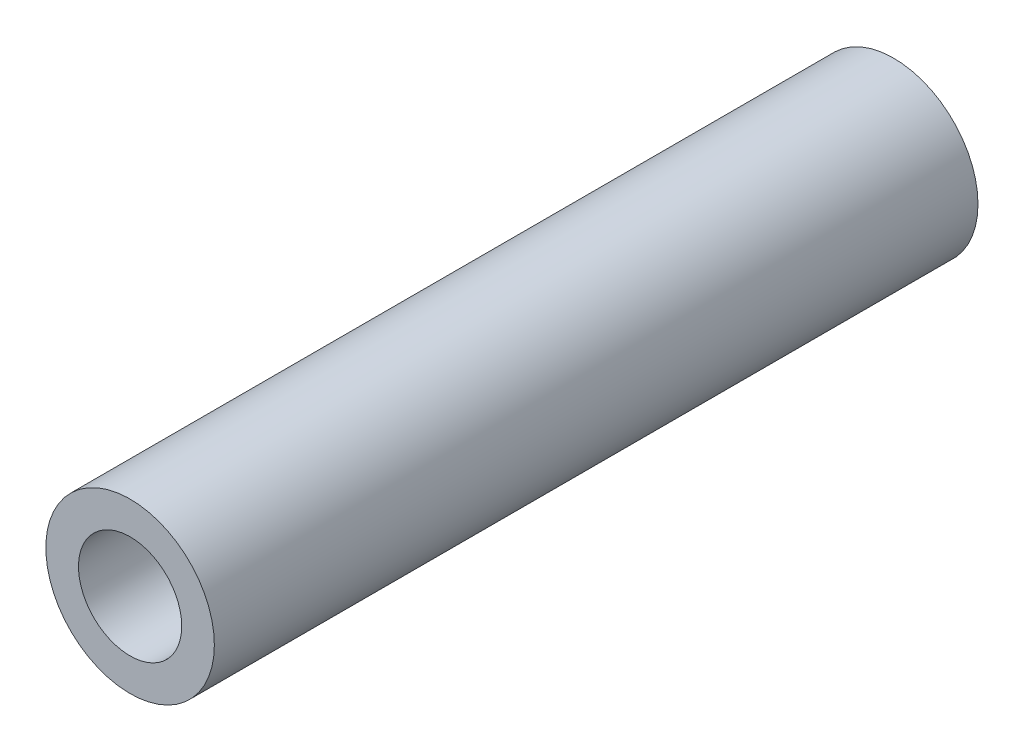
from build123d import *

# Parameters (mm, degrees)
SKETCH1_R           = 4.064
SKETCH1_R_2         = 2.4892
BOSS_EXTRUDE1_DEPTH = 18.415


with BuildPart() as part:
    # Sketch1 → Boss-Extrude1 (new, symmetric)
    with BuildSketch(Plane.XY):
        Circle(SKETCH1_R)
        Circle(SKETCH1_R_2, mode=Mode.SUBTRACT)
    extrude(amount=BOSS_EXTRUDE1_DEPTH, both=True)


solid = part.part
